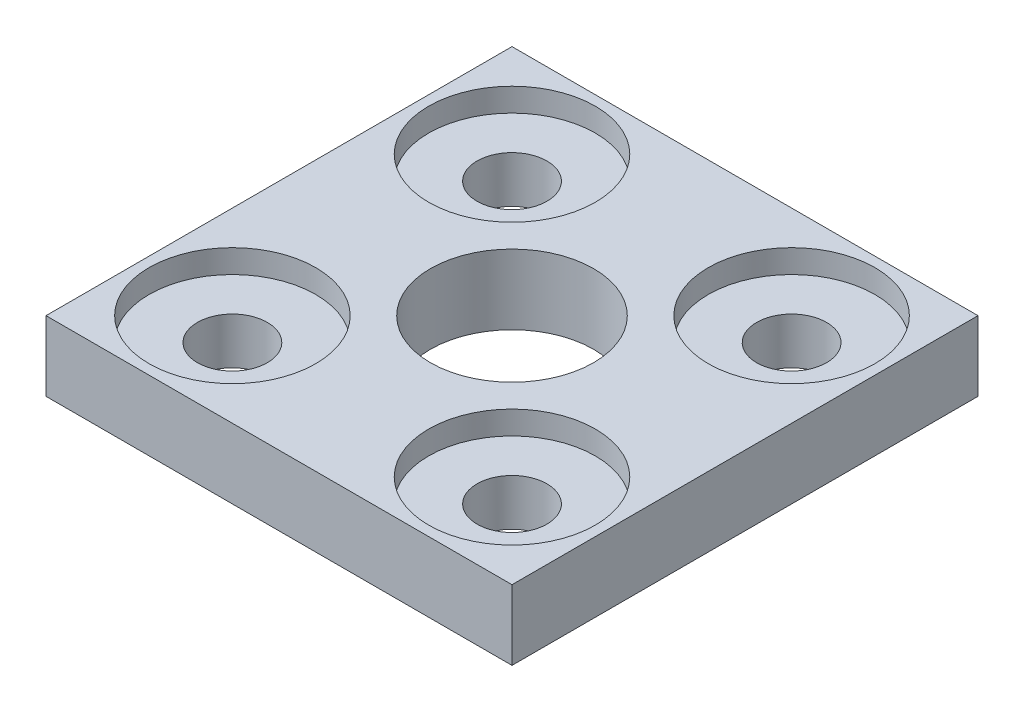
from build123d import *

# Parameters (mm, degrees)
SKETCH1_W           = 20
SKETCH1_H           = 20
SKETCH1_R           = 1.5
SKETCH1_R_2         = 3.5
BOSS_EXTRUDE1_DEPTH = 3
SKETCH2_R           = 3.575
CUT_EXTRUDE1_DEPTH  = 1


with BuildPart() as part:
    # Sketch1 → Boss-Extrude1 (new body)
    with BuildSketch(Plane(origin=(0, 0, 0), x_dir=(1, 0, 0), z_dir=(0, 1, 0))):
        with Locations((10, 10)):
            Rectangle(SKETCH1_W, SKETCH1_H)
        with Locations((16, 16)):
            Circle(SKETCH1_R, mode=Mode.SUBTRACT)
        with Locations((4, 16)):
            Circle(SKETCH1_R, mode=Mode.SUBTRACT)
        with Locations((4, 4)):
            Circle(SKETCH1_R, mode=Mode.SUBTRACT)
        with Locations((16, 4)):
            Circle(SKETCH1_R, mode=Mode.SUBTRACT)
        with Locations((10, 10)):
            Circle(SKETCH1_R_2, mode=Mode.SUBTRACT)
    extrude(amount=BOSS_EXTRUDE1_DEPTH)

    # Sketch2 → Cut-Extrude1 (cut)
    with BuildSketch(Plane(origin=(0, 3, 0), x_dir=(1, 0, 0), z_dir=(0, 1, 0))):
        with Locations((16, 16)):
            Circle(SKETCH2_R)
        with Locations((4, 16)):
            Circle(SKETCH2_R)
        with Locations((16, 4)):
            Circle(SKETCH2_R)
        with Locations((4, 4)):
            Circle(SKETCH2_R)
    extrude(amount=-CUT_EXTRUDE1_DEPTH, mode=Mode.SUBTRACT)


solid = part.part
